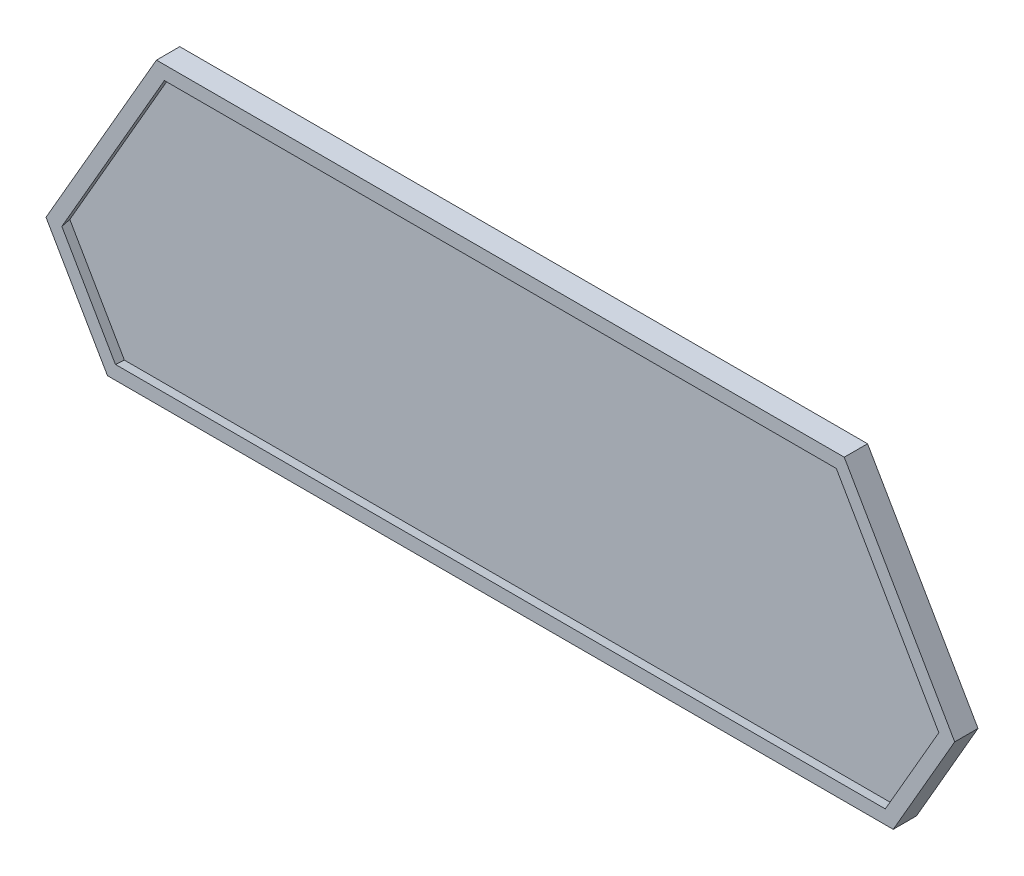
from build123d import *

# Parameters (mm, degrees)
BOSS_EXTRU_1_DEPTH              = 2
EXTRU_MINCE1_DEPTH              = 1.5
EXTRU_MINCE1_DRAFT              = -10
ENL_V_DE_MAT_EXTRU_MINCE1_DEPTH = 83.095164043


with BuildPart() as part:
    # Esquisse1 → Boss.-Extru.1 (new body)
    with BuildSketch(Plane.XY):
        Polygon((-59.024791386, -44.744645862), (2.7, -44.744645862), (59.024791386, -44.744645862), (68.262395693, -28.744645862), (51.666666667, 0), (-51.666666667, 0), (-68.262395693, -28.744645862), align=None)
    extrude(amount=BOSS_EXTRU_1_DEPTH)


with BuildPart() as extru_mince1_tool:
    # Esquisse2 → Extru.-Mince1 (with draft: the straight prism first)
    with BuildSketch(Plane.XY.offset(2)):
        Polygon((-68.262395693, -28.744645862), (-59.024791386, -44.744645862), (59.024791386, -44.744645862), (68.262395693, -28.744645862), (51.666666667, 0), (-51.666666667, 0), align=None)
        Polygon((-66.183934724, -28.744645862), (-57.985560901, -42.944645862), (57.985560901, -42.944645862), (66.183934724, -28.744645862), (50.627436182, -1.8), (-50.627436182, -1.8), align=None, mode=Mode.SUBTRACT)
    extrude(amount=EXTRU_MINCE1_DEPTH)
    # Extru.-Mince1: the draft: its side faces are tilted about the plane it starts from
    extru_mince1_sides = [extru_mince1_tool.faces().sort_by_distance(p)[0] for p in [
        (-63.643593539, -36.744645862, 2.75),
        (0, -44.744645862, 2.75),
        (63.643593539, -36.744645862, 2.75),
        (59.96453118, -14.372322931, 2.75),
        (0, 0, 2.75),
        (-59.96453118, -14.372322931, 2.75),
        (-58.405685453, -15.272322931, 2.75),
        (0, -1.8, 2.75),
        (58.405685453, -15.272322931, 2.75),
        (62.084747813, -35.844645862, 2.75),
        (0, -42.944645862, 2.75),
        (-62.084747813, -35.844645862, 2.75),
    ]]
    draft(extru_mince1_sides, Plane.XY.offset(2), EXTRU_MINCE1_DRAFT)


with BuildPart() as part_1:
    add(part.part)

    # Extru.-Mince1: add extru_mince1_tool
    add(extru_mince1_tool.part)

    # Esquisse3 → Enlèv. de mat.-Extru.-Mince1 (cut, through all)
    with BuildSketch(Plane(origin=(0, 0, 0), x_dir=(-1, 0, 0), z_dir=(0, 0, -1))):
        Polygon((60.121756897, -46.644645862), (70.456326716, -28.744645862), (52.763632178, 1.9), (-52.763632178, 1.9), (-70.456326716, -28.744645862), (-60.121756897, -46.644645862), align=None)
        Polygon((59.024791386, -44.744645862), (68.262395693, -28.744645862), (51.666666667, 0), (-51.666666667, 0), (-68.262395693, -28.744645862), (-59.024791386, -44.744645862), align=None, mode=Mode.SUBTRACT)
    extrude(amount=-ENL_V_DE_MAT_EXTRU_MINCE1_DEPTH, mode=Mode.SUBTRACT)


solid = part_1.part
